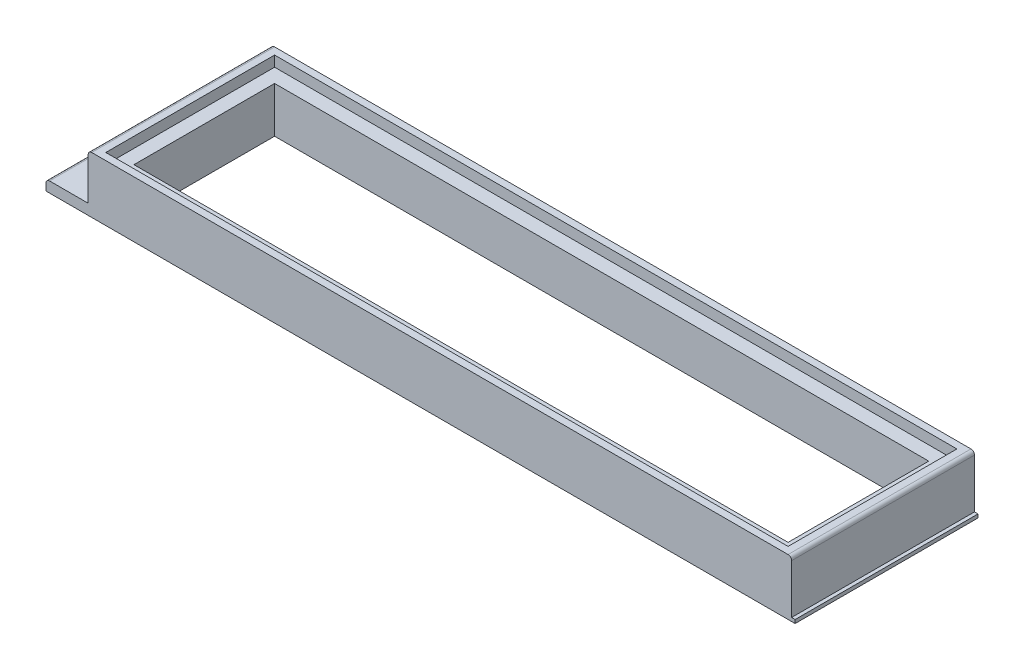
from build123d import *

# Parameters (mm, degrees)
SKETCH1_W                                            = 106.5
SKETCH1_H                                            = 26
BOSS_EXTRUDE1_DEPTH                                  = 8
CUT_EXTRUDE1_START                                   = -26
CUT_EXTRUDE1_OUTLINE_W                               = 6
CUT_EXTRUDE1_OUTLINE_H                               = 6.5
CUT_EXTRUDE1_OUTLINE_W_2                             = 0.5
CUT_EXTRUDE1_OUTLINE_H_2                             = 7.5
CUT_EXTRUDE1_DEPTH                                   = 26
FILLET1_R                                            = 0.5
CSK_FOR_M1_6_COUNTERSUNK_FLAT_HEAD_SCREW_D           = 1.8
CSK_FOR_M1_6_COUNTERSUNK_FLAT_HEAD_SCREW_DEPTH       = 15
CSK_FOR_M1_6_COUNTERSUNK_FLAT_HEAD_SCREW_CSINK_D     = 3.6
CSK_FOR_M1_6_COUNTERSUNK_FLAT_HEAD_SCREW_CSINK_ANGLE = 90
CSK_FOR_M1_6_COUNTERSUNK_FLAT_HEAD_SCREW_TIP         = 0.540774557
SKETCH14_W                                           = 97
SKETCH14_H                                           = 24
CUT_EXTRUDE7_DEPTH                                   = 110.919288571
SKETCH14_3_W                                         = 97
SKETCH14_3_H                                         = 24
BOSS_EXTRUDE3_DEPTH                                  = 1
SKETCH18_W                                           = 97
SKETCH18_H                                           = 24
CUT_EXTRUDE8_DEPTH                                   = 10
SKETCH20_W                                           = 97
SKETCH20_H                                           = 24
SKETCH20_W_2                                         = 93
SKETCH20_H_2                                         = 20
BOSS_EXTRUDE4_DEPTH                                  = 8
SKETCH20_2_W                                         = 97
SKETCH20_2_H                                         = 24
SKETCH20_2_W_2                                       = 93
SKETCH20_2_H_2                                       = 20
CUT_EXTRUDE9_DEPTH                                   = 1.5


# Read off the part's stored shape, not the designer's step: Cut-Extrude1
with BuildPart() as part:
    # Sketch1 → Boss-Extrude1 (new body)
    with BuildSketch(Plane(origin=(0, 0, 0), x_dir=(1, 0, 0), z_dir=(0, 1, 0))):
        with Locations((53.25, -13)):
            Rectangle(SKETCH1_W, SKETCH1_H)
    extrude(amount=BOSS_EXTRUDE1_DEPTH)

    # Cut-Extrude1 outline → Cut-Extrude1 (cut)
    with BuildSketch(Plane.XY.offset(26).offset(CUT_EXTRUDE1_START)):
        with Locations((3, 4.75)):
            Rectangle(CUT_EXTRUDE1_OUTLINE_W, CUT_EXTRUDE1_OUTLINE_H)
        with Locations((106.25, 4.25)):
            Rectangle(CUT_EXTRUDE1_OUTLINE_W_2, CUT_EXTRUDE1_OUTLINE_H_2)
    extrude(amount=CUT_EXTRUDE1_DEPTH, mode=Mode.SUBTRACT)

    # Fillet1
    fillet1_edges = [part.edges().sort_by_distance(p)[0] for p in [
        (106, 8, 13),
        (0, 1.5, 13),
        (6, 8, 13),
    ]]
    fillet(fillet1_edges, radius=FILLET1_R)

    # CSK for M1.6 Countersunk Flat Head Screw1
    with Locations(Plane(origin=(3, 1.5, 13), x_dir=(1, 0, 0), z_dir=(0, 1, 0))):
        with Locations((0, 0)):
            CounterSinkHole(CSK_FOR_M1_6_COUNTERSUNK_FLAT_HEAD_SCREW_D / 2, CSK_FOR_M1_6_COUNTERSUNK_FLAT_HEAD_SCREW_CSINK_D / 2, depth=CSK_FOR_M1_6_COUNTERSUNK_FLAT_HEAD_SCREW_DEPTH, counter_sink_angle=CSK_FOR_M1_6_COUNTERSUNK_FLAT_HEAD_SCREW_CSINK_ANGLE)
            with Locations((0, 0, -(CSK_FOR_M1_6_COUNTERSUNK_FLAT_HEAD_SCREW_DEPTH + CSK_FOR_M1_6_COUNTERSUNK_FLAT_HEAD_SCREW_TIP / 2))):  # 118° drill point
                Cone(0, CSK_FOR_M1_6_COUNTERSUNK_FLAT_HEAD_SCREW_D / 2, CSK_FOR_M1_6_COUNTERSUNK_FLAT_HEAD_SCREW_TIP, mode=Mode.SUBTRACT)

    # Sketch14 → Cut-Extrude7 (cut, through all)
    with BuildSketch(Plane(origin=(0, 8, 0), x_dir=(1, 0, 0), z_dir=(0, 1, 0))):
        with Locations((56, -13)):
            Rectangle(SKETCH14_W, SKETCH14_H)
    extrude(amount=-CUT_EXTRUDE7_DEPTH, mode=Mode.SUBTRACT)

    # Sketch14<3> → Boss-Extrude3 (add)
    with BuildSketch(Plane(origin=(0, 8, 0), x_dir=(1, 0, 0), z_dir=(0, 1, 0))):
        with Locations((56, -13)):
            Rectangle(SKETCH14_3_W, SKETCH14_3_H)
    extrude(amount=-BOSS_EXTRUDE3_DEPTH)

    # Sketch18 → Cut-Extrude8 (cut)
    with BuildSketch(Plane(origin=(0, 0, 0), x_dir=(1, 0, 0), z_dir=(0, 1, 0))):
        with Locations((56, -13)):
            Rectangle(SKETCH18_W, SKETCH18_H)
    extrude(amount=CUT_EXTRUDE8_DEPTH, mode=Mode.SUBTRACT)

    # Sketch20 → Boss-Extrude4 (add)
    with BuildSketch(Plane(origin=(0, 8, 0), x_dir=(1, 0, 0), z_dir=(0, 1, 0))):
        with Locations((56, -13)):
            Rectangle(SKETCH20_W, SKETCH20_H)
        with Locations((56, -13)):
            Rectangle(SKETCH20_W_2, SKETCH20_H_2, mode=Mode.SUBTRACT)
    extrude(amount=-BOSS_EXTRUDE4_DEPTH)

    # Sketch20<2> → Cut-Extrude9 (cut)
    with BuildSketch(Plane(origin=(0, 8, 0), x_dir=(1, 0, 0), z_dir=(0, 1, 0))):
        with Locations((56, -13)):
            Rectangle(SKETCH20_2_W, SKETCH20_2_H)
        with Locations((56, -13)):
            Rectangle(SKETCH20_2_W_2, SKETCH20_2_H_2, mode=Mode.SUBTRACT)
    extrude(amount=-CUT_EXTRUDE9_DEPTH, mode=Mode.SUBTRACT)


solid = part.part
